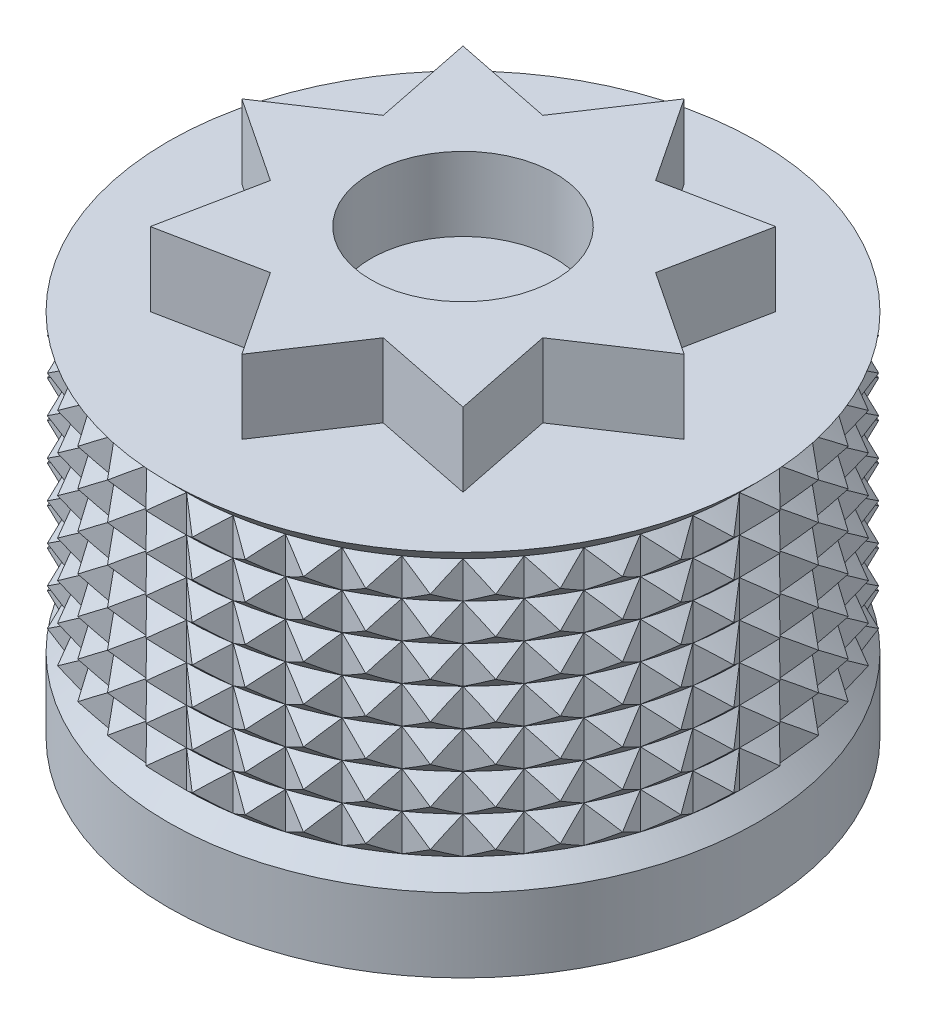
from build123d import *

# Parameters (mm, degrees)
SKETCH3_OUTSIDE_W   = 23.122
SKETCH3_OUTSIDE_H   = 23.122
CUT_EXTRUDE2_DEPTH  = 7
SKETCH5_R           = 7
CUT_EXTRUDE4_DEPTH  = 1
CUT_EXTRUDE3_DEPTH  = 8
BOSS_EXTRUDE2_START = -1
BOSS_EXTRUDE2_DEPTH = 7
SKETCH7_OUTSIDE_W   = 23.122
SKETCH7_OUTSIDE_H   = 23.122
SKETCH7_OUTSIDE_R   = 2.5
CUT_EXTRUDE5_DEPTH  = 2


with BuildPart() as part:
    # Sketch2 → Revolve1 (revolve)
    with BuildSketch(Plane.XY, mode=Mode.PRIVATE) as revolve1_sk:
        with BuildLine():
            Line((0, 0), (0, 12))
            Line((0, 12), (7, 12))
            ThreePointArc((7, 12), (7.707106781, 11.707106781), (8, 11))
            Line((8, 11), (8, 10))
            Line((8, 10), (7.5, 9.5))
            Line((7.5, 9.5), (8, 9))
            Line((8, 9), (7.5, 8.5))
            Line((7.5, 8.5), (8, 8))
            Line((8, 8), (7.5, 7.5))
            Line((7.5, 7.5), (8, 7))
            Line((8, 7), (7.5, 6.5))
            Line((7.5, 6.5), (8, 6))
            Line((8, 6), (7.5, 5.5))
            Line((7.5, 5.5), (8, 5))
            Line((8, 5), (7.5, 4.5))
            Line((7.5, 4.5), (8, 4))
            Line((8, 4), (7.5, 3.5))
            Line((7.5, 3.5), (8, 3))
            Line((8, 3), (7.5, 2.5))
            Line((7.5, 2.5), (8, 2))
            Line((8, 2), (8, 0))
            Line((8, 0), (0, 0))
        make_face()
    revolve(revolve1_sk.sketch.rotate(Axis((0, 0, 0), (0, 1, 0)), 90), axis=Axis((0, 0, 0), (0, 1, 0)))

    # Sketch3 outside → Cut-Extrude2 (cut)
    with BuildSketch(Plane(origin=(0, 9.5, 0), x_dir=(1, 0, 0), z_dir=(0, 1, 0))):
        Rectangle(SKETCH3_OUTSIDE_W, SKETCH3_OUTSIDE_H)
        Polygon((0, 7.5), (0.627672766, 7.97533867), (1.173258488, 7.407662554), (1.867562911, 7.778959363), (2.317627458, 7.132923872), (3.061467459, 7.39103626), (3.404928748, 6.682548931), (4.179988518, 6.821121315), (4.408389392, 6.067627458), (5.195584387, 6.083247725), (5.303300859, 5.303300859), (6.083247725, 5.195584387), (6.067627458, 4.408389392), (6.821121315, 4.179988518), (6.682548931, 3.404928748), (7.39103626, 3.061467459), (7.132923872, 2.317627458), (7.778959363, 1.867562911), (7.407662554, 1.173258488), (7.97533867, 0.627672766), (7.5, 0), (7.97533867, -0.627672766), (7.407662554, -1.173258488), (7.778959363, -1.867562911), (7.132923872, -2.317627458), (7.39103626, -3.061467459), (6.682548931, -3.404928748), (6.821121315, -4.179988518), (6.067627458, -4.408389392), (6.083247725, -5.195584387), (5.303300859, -5.303300859), (5.195584387, -6.083247725), (4.408389392, -6.067627458), (4.179988518, -6.821121315), (3.404928748, -6.682548931), (3.061467459, -7.39103626), (2.317627458, -7.132923872), (1.867562911, -7.778959363), (1.173258488, -7.407662554), (0.627672766, -7.97533867), (0, -7.5), (-0.627672766, -7.97533867), (-1.173258488, -7.407662554), (-1.867562911, -7.778959363), (-2.317627458, -7.132923872), (-3.061467459, -7.39103626), (-3.404928748, -6.682548931), (-4.179988518, -6.821121315), (-4.408389392, -6.067627458), (-5.195584387, -6.083247725), (-5.303300859, -5.303300859), (-6.083247725, -5.195584387), (-6.067627458, -4.408389392), (-6.821121315, -4.179988518), (-6.682548931, -3.404928748), (-7.39103626, -3.061467459), (-7.132923872, -2.317627458), (-7.778959363, -1.867562911), (-7.407662554, -1.173258488), (-7.97533867, -0.627672766), (-7.5, 0), (-7.97533867, 0.627672766), (-7.407662554, 1.173258488), (-7.778959363, 1.867562911), (-7.132923872, 2.317627458), (-7.39103626, 3.061467459), (-6.682548931, 3.404928748), (-6.821121315, 4.179988518), (-6.067627458, 4.408389392), (-6.083247725, 5.195584387), (-5.303300859, 5.303300859), (-5.195584387, 6.083247725), (-4.408389392, 6.067627458), (-4.179988518, 6.821121315), (-3.404928748, 6.682548931), (-3.061467459, 7.39103626), (-2.317627458, 7.132923872), (-1.867562911, 7.778959363), (-1.173258488, 7.407662554), (-0.627672766, 7.97533867), align=None, mode=Mode.SUBTRACT)
    extrude(amount=-CUT_EXTRUDE2_DEPTH, mode=Mode.SUBTRACT)

    # Sketch5 → Cut-Extrude4 (cut)
    with BuildSketch(Plane.XZ):
        with Locations(Location((0, 0, 0), (0, 0, 270))):
            Circle(SKETCH5_R)
    extrude(amount=-CUT_EXTRUDE4_DEPTH, mode=Mode.SUBTRACT)

    # Sketch4 → Cut-Extrude3 (cut)
    with BuildSketch(Plane.XZ.offset(-1)):
        with BuildLine():
            Line((-2.711088342, 1.7), (2.711088342, 1.7))
            ThreePointArc((2.711088342, 1.7), (0, -3.2), (-2.711088342, 1.7))
        make_face()
    extrude(amount=-CUT_EXTRUDE3_DEPTH, mode=Mode.SUBTRACT)

    # Sketch6 → Boss-Extrude2 (add)
    with BuildSketch(Plane.XZ.offset(-1).offset(BOSS_EXTRUDE2_START)):
        Polygon((-2.4, 1.7), (-2.2, 1.35), (-2, 1.7), align=None)
        Polygon((-3.2, 0.2), (-3.2, -0.2), (-2.85, 0), align=None)
        Polygon((-2.969877125, -1.208234192), (-2.796323629, -1.568621739), (-2.567761274, -1.236568656), align=None)
        Polygon((-2.151533662, -2.377162784), (-1.838801069, -2.626558704), (-1.776945935, -2.228219725), align=None)
        Polygon((-0.907052571, -3.075265132), (-0.517081406, -3.164273506), (-0.634184662, -2.77854455), align=None)
        Polygon((0.517081406, -3.164273506), (0.907052571, -3.075265132), (0.634184662, -2.77854455), align=None)
        Polygon((1.838801069, -2.626558704), (2.151533662, -2.377162784), (1.776945935, -2.228219725), align=None)
        Polygon((2.796323629, -1.568621739), (2.969877125, -1.208234192), (2.567761274, -1.236568656), align=None)
        Polygon((3.2, -0.2), (3.2, 0.2), (2.85, 0), align=None)
        Polygon((-1.3, 1.7), (-1.1, 1.35), (-0.9, 1.7), align=None)
        Polygon((-0.2, 1.7), (0, 1.35), (0.2, 1.7), align=None)
        Polygon((0.9, 1.7), (1.1, 1.35), (1.3, 1.7), align=None)
        Polygon((2, 1.7), (2.2, 1.35), (2.4, 1.7), align=None)
    extrude(amount=-BOSS_EXTRUDE2_DEPTH)

    # Sketch7 outside → Cut-Extrude5 (cut)
    # profile 1 of 2: a face of its own
    with BuildSketch(Plane(origin=(0, 12, 0), x_dir=(1, 0, 0), z_dir=(0, 1, 0))):
        Rectangle(SKETCH7_OUTSIDE_W, SKETCH7_OUTSIDE_H)
        Polygon((-1.530733729, 3.69551813), (0, 6), (1.530733729, 3.69551813), (4.242640687, 4.242640687), (3.69551813, 1.530733729), (6, 0), (3.69551813, -1.530733729), (4.242640687, -4.242640687), (1.530733729, -3.69551813), (0, -6), (-1.530733729, -3.69551813), (-4.242640687, -4.242640687), (-3.69551813, -1.530733729), (-6, 0), (-3.69551813, 1.530733729), (-4.242640687, 4.242640687), align=None, mode=Mode.SUBTRACT)
    # profile 2 of 2: a face of its own
    with BuildSketch(Plane(origin=(0, 12, 0), x_dir=(1, 0, 0), z_dir=(0, 1, 0))):
        with Locations(Location((0, 0, 0), (0, 0, 270))):
            Circle(SKETCH7_OUTSIDE_R)
    extrude(amount=-CUT_EXTRUDE5_DEPTH, mode=Mode.SUBTRACT)


solid = part.part
